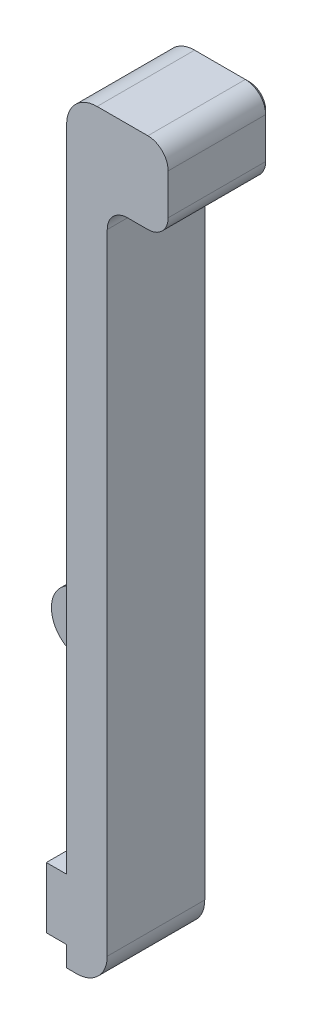
from build123d import *

# Parameters (mm, degrees)
SKETCH1_R           = 1.7
BOSS_EXTRUDE1_DEPTH = 12.7
SKETCH2_W           = 6.35
SKETCH2_H           = 10.16
CUT_EXTRUDE1_DEPTH  = 20.32
CHAMFER1_SIZE       = 0.5


with BuildPart() as part:
    # Sketch1 → Boss-Extrude1 (new body)
    with BuildSketch(Plane.XY):
        with BuildLine():
            Line((2.54, 47.625), (7.62, 47.625))
            ThreePointArc((7.62, 47.625), (9.416051224, 46.881051224), (10.16, 45.085))
            Line((10.16, 45.085), (10.16, 40.005))
            ThreePointArc((10.16, 40.005), (9.416051224, 38.208948776), (7.62, 37.465))
            Line((7.62, 37.465), (5.08, 37.465))
            ThreePointArc((5.08, 37.465), (3.283948776, 36.721051224), (2.54, 34.925))
            Line((2.54, 34.925), (2.54, -43.815))
            ThreePointArc((2.54, -43.815), (1.424076836, -46.509076836), (-1.27, -47.625))
            Line((-1.27, -47.625), (-2.54, -47.625))
            Line((-2.54, -47.625), (-2.54, -45.085))
            Line((-2.54, -45.085), (-5.08, -45.085))
            Line((-5.08, -45.085), (-5.08, -37.465))
            Line((-5.08, -37.465), (-2.54, -37.465))
            Line((-2.54, -37.465), (-2.54, -20.955))
            ThreePointArc((-2.54, -20.955), (-2.911974388, -20.056974388), (-3.81, -19.685))
            Line((-3.81, -19.685), (-6.985, -19.685))
            ThreePointArc((-6.985, -19.685), (-10.795, -15.875), (-6.985, -12.065))
            Line((-6.985, -12.065), (-3.81, -12.065))
            ThreePointArc((-3.81, -12.065), (-2.911974388, -11.693025612), (-2.54, -10.795))
            Line((-2.54, -10.795), (-2.54, 43.815))
            ThreePointArc((-2.54, 43.815), (-1.424076836, 46.509076836), (1.27, 47.625))
            Line((1.27, 47.625), (2.54, 47.625))
        make_face()
        with Locations((-6.985, -15.875)):
            Circle(SKETCH1_R, mode=Mode.SUBTRACT)
    extrude(amount=BOSS_EXTRUDE1_DEPTH)

    # Sketch2 → Cut-Extrude1 (cut)
    with BuildSketch(Plane.ZY.offset(2.54)):
        with Locations((9.525, -15.875)):
            Rectangle(SKETCH2_W, SKETCH2_H)
    extrude(amount=CUT_EXTRUDE1_DEPTH, mode=Mode.SUBTRACT)

    # Chamfer1
    chamfer1_edges = [part.edges().sort_by_distance(p)[0] for p in [
        (-8.685, -15.875, 0),
        (-1.905, -47.625, 0),
        (1.424076836, -46.509076836, 0),
        (2.54, -4.445, 0),
        (3.283948776, 36.721051224, 0),
        (6.35, 37.465, 0),
        (9.416051224, 38.208948776, 0),
        (10.16, 42.545, 0),
        (9.416051224, 46.881051224, 0),
        (4.445, 47.625, 0),
        (-1.424076836, 46.509076836, 0),
        (-2.54, 16.51, 0),
        (-2.911974388, -11.693025612, 0),
        (-5.3975, -12.065, 0),
        (-10.795, -15.875, 0),
        (-5.3975, -19.685, 0),
        (-2.911974388, -20.056974388, 0),
        (-2.54, -29.21, 0),
        (-3.81, -37.465, 0),
        (-5.08, -41.275, 0),
        (-3.81, -45.085, 0),
        (-2.54, -46.355, 0),
    ]]
    chamfer(chamfer1_edges, length=CHAMFER1_SIZE)


solid = part.part
